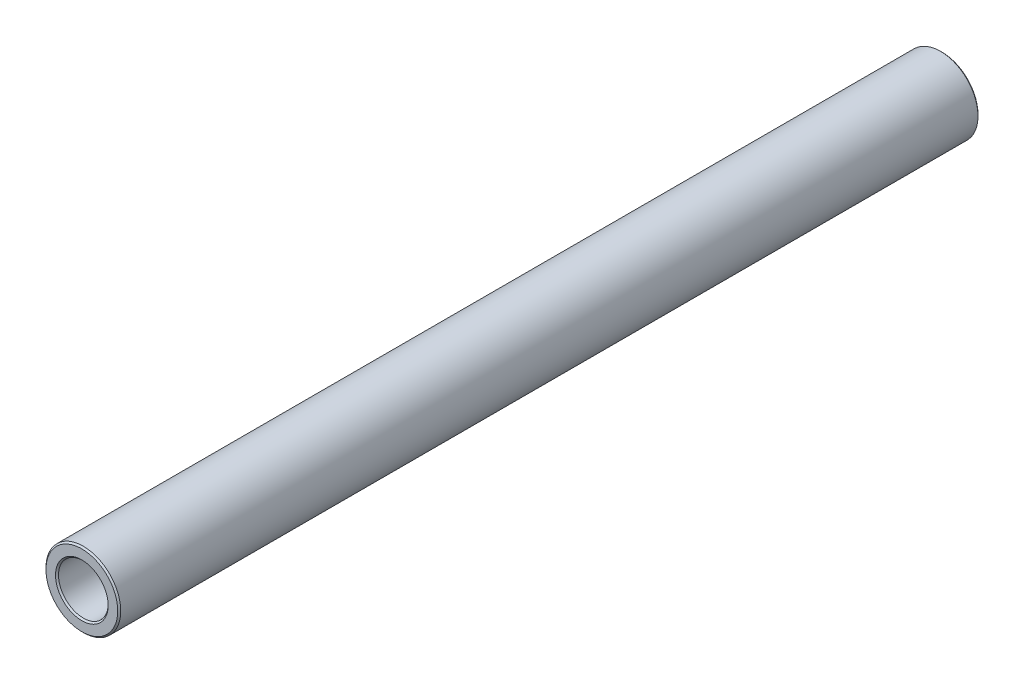
from build123d import *

# Parameters (mm, degrees)
SKETCH1_R           = 3.175
SKETCH1_R_2         = 2.1082
BOSS_EXTRUDE1_DEPTH = 73.025
CHAMFER1_SIZE       = 0.127


with BuildPart() as part:
    # Sketch1 → Boss-Extrude1 (new body)
    with BuildSketch(Plane.XY):
        Circle(SKETCH1_R)
        Circle(SKETCH1_R_2, mode=Mode.SUBTRACT)
    extrude(amount=BOSS_EXTRUDE1_DEPTH)

    # Chamfer1
    chamfer1_edges = [part.edges().sort_by_distance(p)[0] for p in [
        (-2.1082, 0, 0),
        (-3.175, 0, 0),
        (-2.1082, 0, 73.025),
        (-3.175, 0, 73.025),
    ]]
    chamfer(chamfer1_edges, length=CHAMFER1_SIZE)


solid = part.part
